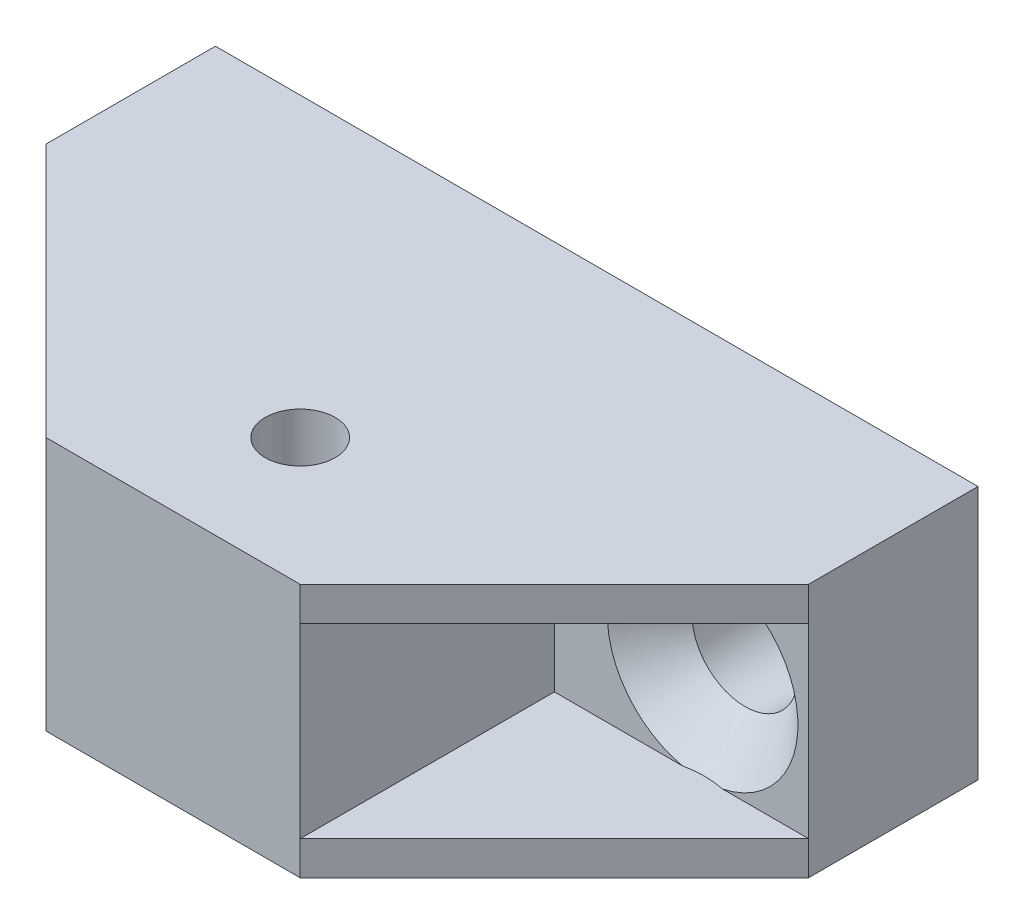
from build123d import *

# Parameters (mm, degrees)
ESQUISSE1_W                  = 36
ESQUISSE1_H                  = 12
BOSS_EXTRU_1_DEPTH           = 8
ENL_V_MAT_EXTRU_1_DEPTH      = 39.781438859
ENL_V_MAT_EXTRU_1_DEPTH_BACK = 39.781438859
ESQUISSE2_R                  = 2.5
ESQUISSE3_W                  = 12
ESQUISSE3_H                  = 12
BOSS_EXTRU_2_DEPTH           = 12
ENL_V_MAT_EXTRU_2_DEPTH      = 43.895221179
ENL_V_MAT_EXTRU_2_DEPTH_BACK = 43.895221179
ESQUISSE4_R                  = 1.65
BOSS_EXTRU_3_DEPTH           = 1.6
BOSS_EXTRU_4_START           = -12
BOSS_EXTRU_4_DEPTH           = 1.6
CHANFREIN1_SIZE              = 2


with BuildPart() as part:
    # Esquisse1 → Boss.-Extru.1 (new body)
    with BuildSketch(Plane.XY):
        with Locations((18, 6)):
            Rectangle(ESQUISSE1_W, ESQUISSE1_H)
    extrude(amount=BOSS_EXTRU_1_DEPTH)

    # Esquisse2 → Enlèv. mat.-Extru.1 (cut, two sides: drawn at the far end of the back side and taken through both)
    with BuildSketch(Plane.XY.offset(8).offset(-ENL_V_MAT_EXTRU_1_DEPTH_BACK)):
        with Locations((5, 6)):
            Circle(ESQUISSE2_R)
        with Locations(Location((31, 6, 0), (0, 0, 180))):
            Circle(ESQUISSE2_R)
    extrude(amount=ENL_V_MAT_EXTRU_1_DEPTH + ENL_V_MAT_EXTRU_1_DEPTH_BACK, mode=Mode.SUBTRACT)

    # Esquisse3 → Boss.-Extru.2 (add)
    with BuildSketch(Plane(origin=(0, 12, 0), x_dir=(1, 0, 0), z_dir=(0, 1, 0))):
        with Locations((18, -14)):
            Rectangle(ESQUISSE3_W, ESQUISSE3_H)
    extrude(amount=-BOSS_EXTRU_2_DEPTH)

    # Esquisse4 → Enlèv. mat.-Extru.2 (cut, two sides: drawn at the far end of the back side and taken through both)
    with BuildSketch(Plane(origin=(0, 12, 0), x_dir=(1, 0, 0), z_dir=(0, 1, 0)).offset(-ENL_V_MAT_EXTRU_2_DEPTH_BACK)):
        with Locations(Location((18, -14, 0), (0, 0, 270))):
            Circle(ESQUISSE4_R)
    extrude(amount=ENL_V_MAT_EXTRU_2_DEPTH + ENL_V_MAT_EXTRU_2_DEPTH_BACK, mode=Mode.SUBTRACT)

    # Esquisse5 → Boss.-Extru.3 (add)
    with BuildSketch(Plane.XZ):
        Polygon((12, 8), (0, 8), (12, 20), align=None)
        Polygon((24, 20), (24, 8), (36, 8), align=None)
    extrude(amount=-BOSS_EXTRU_3_DEPTH)

    # Esquisse5<2> → Boss.-Extru.4 (add)
    with BuildSketch(Plane.XZ.offset(BOSS_EXTRU_4_START)):
        Polygon((12, 8), (0, 8), (12, 20), align=None)
        Polygon((24, 20), (24, 8), (36, 8), align=None)
    extrude(amount=BOSS_EXTRU_4_DEPTH)

    # Chanfrein1
    # the kernel refuses this chamfer: 2 mm, written as the material it takes off along each edge
    with BuildSketch(Plane(origin=(5, 6, 8), x_dir=(1, 0, 0), z_dir=(0, -1, 0))) as chanfrein1_piece_1_section:
        Polygon((2.5 + CHANFREIN1_SIZE, 0), (2.5, -CHANFREIN1_SIZE), (2.5, 0), align=None)
    chanfrein1_piece_1 = revolve(axis=Axis((5, 6, 8), (0, 0, 1)), mode=Mode.PRIVATE)
    chanfrein1_piece_1 = split(chanfrein1_piece_1, bisect_by=Plane(origin=(1.524895904, 1.6, 7.024895904), z_dir=(0, 1, 0)), keep=Keep.TOP, mode=Mode.PRIVATE)
    chanfrein1_piece_1 = split(chanfrein1_piece_1, bisect_by=Plane(origin=(1.524895904, 10.4, 7.024895904), z_dir=(0, -1, 0)), keep=Keep.TOP, mode=Mode.PRIVATE)
    add(chanfrein1_piece_1, mode=Mode.SUBTRACT)
    with BuildSketch(Plane(origin=(31, 6, 8), x_dir=(-1, 0, 0), z_dir=(0, 1, 0))) as chanfrein1_piece_2_section:
        Polygon((2.5 + CHANFREIN1_SIZE, 0), (2.5, -CHANFREIN1_SIZE), (2.5, 0), align=None)
    chanfrein1_piece_2 = revolve(axis=Axis((31, 6, 8), (0, 0, 1)), mode=Mode.PRIVATE)
    chanfrein1_piece_2 = split(chanfrein1_piece_2, bisect_by=Plane(origin=(34.475104096, 1.6, 7.024895904), z_dir=(0, 1, 0)), keep=Keep.TOP, mode=Mode.PRIVATE)
    chanfrein1_piece_2 = split(chanfrein1_piece_2, bisect_by=Plane(origin=(34.475104096, 10.4, 7.024895904), z_dir=(0, -1, 0)), keep=Keep.TOP, mode=Mode.PRIVATE)
    add(chanfrein1_piece_2, mode=Mode.SUBTRACT)


solid = part.part
